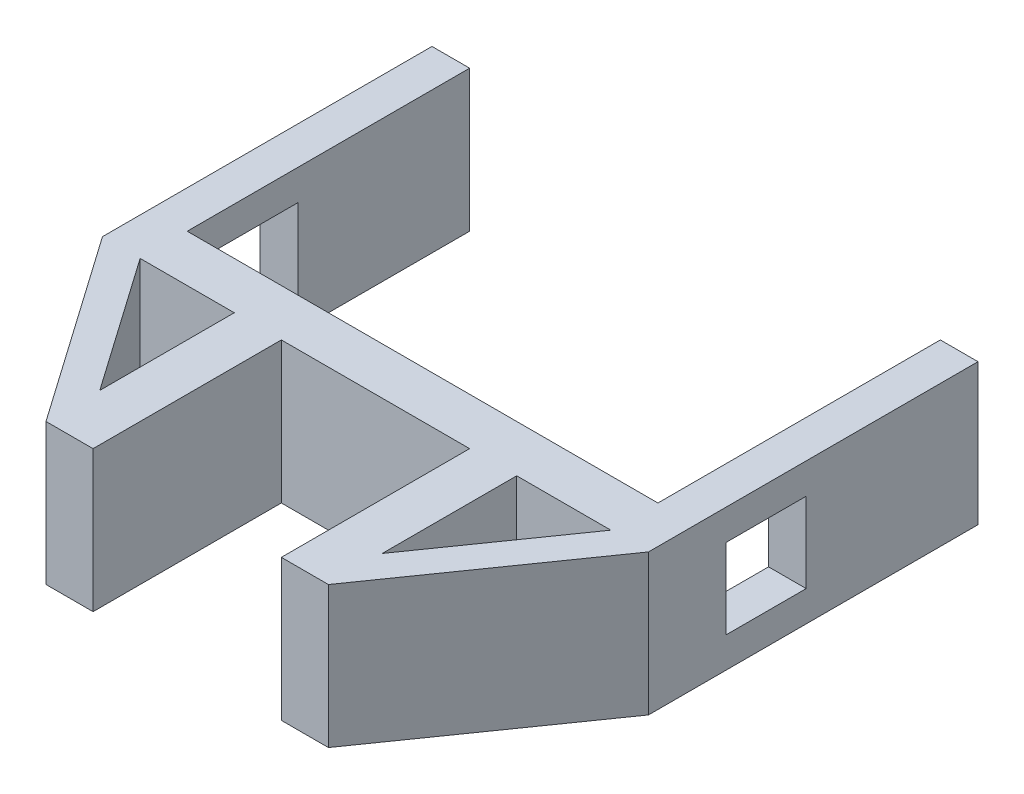
from build123d import *

# Parameters (mm, degrees)
BOSS_EXTRUDE1_DEPTH     = 15
CUT_EXTRUDE1_DEPTH      = 85.787970845
CUT_EXTRUDE1_DEPTH_BACK = 85.787970845
SKETCH2_W               = 17
SKETCH2_H               = 17


with BuildPart() as part:
    # Sketch1 → Boss-Extrude1 (new, symmetric)
    with BuildSketch(Plane(origin=(0, 0, 0), x_dir=(1, 0, 0), z_dir=(0, 1, 0))):
        Polygon((-50, 0), (-50, 60), (-58, 60), (-58, -10), (-30, -50), (-20, -50), (-20, -10), (20, -10), (20, -50), (30, -50), (58, -10), (58, 60), (50, 60), (50, 0), align=None)
        Polygon((-30, -10), (-30, -38.571428571), (-50, -10), align=None, mode=Mode.SUBTRACT)
        Polygon((30, -10), (50, -10), (30, -38.571428571), align=None, mode=Mode.SUBTRACT)
    extrude(amount=BOSS_EXTRUDE1_DEPTH, both=True)

    # Sketch2 → Cut-Extrude1 (cut, two sides: drawn at the far end of the back side and taken through both)
    with BuildSketch(Plane(origin=(0, 0, 0), x_dir=(0, 0, -1), z_dir=(1, 0, 0)).offset(-CUT_EXTRUDE1_DEPTH_BACK)):
        with Locations((15, 0)):
            Rectangle(SKETCH2_W, SKETCH2_H)
    extrude(amount=CUT_EXTRUDE1_DEPTH + CUT_EXTRUDE1_DEPTH_BACK, mode=Mode.SUBTRACT)


solid = part.part
